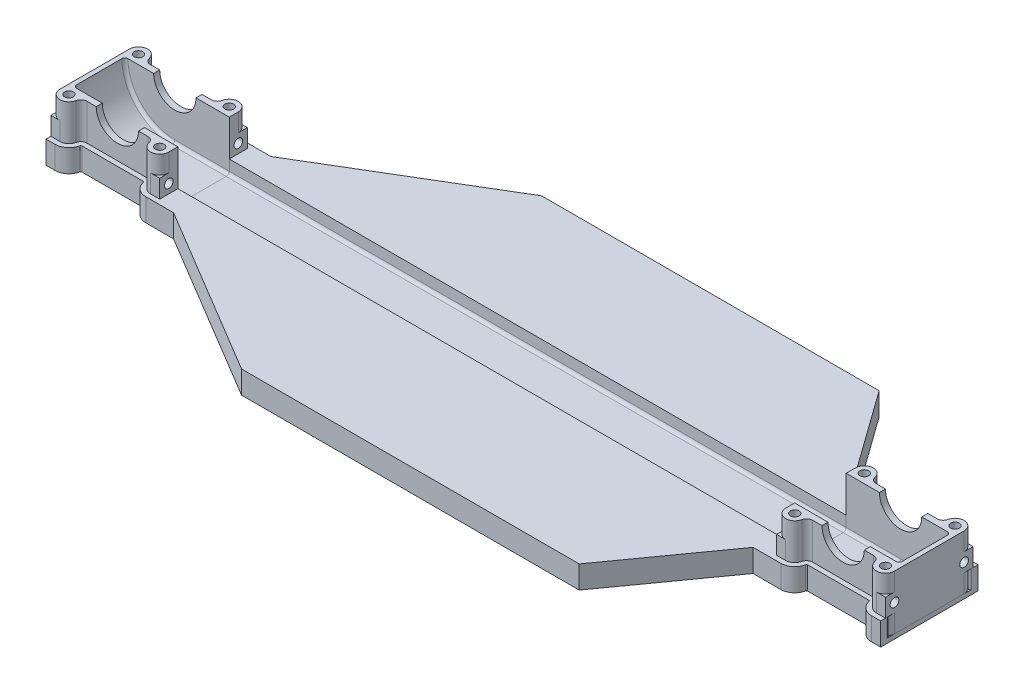
from build123d import *

# Parameters (mm, degrees)
BOSS_EXTRUDE1_DEPTH      = 13.493749999999999
BOSS_EXTRUDE2_START      = -16.66875
BOSS_EXTRUDE2_DEPTH      = 3.174999999999999
BOSS_EXTRUDE3_START      = 16.66875
BOSS_EXTRUDE3_DEPTH      = 3.175
BOSS_EXTRUDE4_DEPTH      = 28.575
FILLET3_R                = 1.5875
CUT_EXTRUDE1_DEPTH       = 47.507247839046556
CUT_EXTRUDE1_DEPTH_BACK  = 47.507247839046556
SKETCH2_3_R              = 2.2859999999999983
FILLET7_R                = 3.175
SKETCH3_R                = 2.2859999999999547
SKETCH3_R_2              = 2.286
BOSS_EXTRUDE5_DEPTH      = 2.38125
BOSS_EXTRUDE6_DEPTH      = 2.38125
BOSS_EXTRUDE7_DEPTH      = 9.525
FILLET8_R                = 1.5875
SKETCH4_R                = 2.2859999999999774
SKETCH4_R_2              = 2.2859999999999983
BOSS_EXTRUDE8_DEPTH      = 9.525
SKETCH7_R                = 2.286000000000005
SKETCH7_R_2              = 2.286000000000001
CUT_EXTRUDE7_DEPTH       = 7.9375
CUT_EXTRUDE8_START       = -381
SKETCH7_2_R              = 2.286000000000005
SKETCH7_2_R_2            = 2.286000000000001
CUT_EXTRUDE8_DEPTH       = 7.9375
CUT_EXTRUDE9_START       = -49.2125
SKETCH7_3_R              = 2.286000000000005
SKETCH7_3_R_2            = 2.286000000000001
CUT_EXTRUDE9_DEPTH       = 7.9375
CUT_EXTRUDE10_START      = -430.2125
SKETCH7_4_R              = 2.286000000000005
SKETCH7_4_R_2            = 2.286000000000001
CUT_EXTRUDE10_DEPTH      = 7.9375
CUT_EXTRUDE11_DEPTH      = 421.7101736814342
CUT_EXTRUDE11_DEPTH_BACK = 421.7101736814342
FILLET10_R               = 0.79375


with BuildPart() as part:
    # Sketch1 → Boss-Extrude1 (new, symmetric)
    with BuildSketch(Plane.XY):
        with BuildLine():
            Line((-26.193749999999998, 0), (-28.575, 0))
            ThreePointArc((-28.575, 0), (-20.205576275451392, -20.205576269359803), (-8.61481042e-09, -28.575))
            ThreePointArc((-8.61481042e-09, -28.575), (5.832847445786352, -27.973353672275042), (11.420073814889577, -26.19374999999949))
            Line((11.420073814889678, -26.193749999999998), (0, -26.193749999999998))
            ThreePointArc((1.06e-15, -26.193749999999994), (-18.521778249705125, -18.521778249705125), (-26.193749999999998, 0))
        make_face()
        with BuildLine():
            ThreePointArc((11.420073814889577, -26.19374999999949), (5.832847445786352, -27.973353672275042), (-8.61481042e-09, -28.575))
            Line((-8.61481197e-09, -28.575), (28.574999999999996, -28.575))
            Line((28.574999999999996, -28.575), (28.574999999999996, -26.193749999999998))
            Line((28.574999999999996, -26.193749999999998), (11.420073814889678, -26.193749999999998))
        make_face()
        with BuildLine():
            ThreePointArc((-8.61481042e-09, -28.575), (-20.205576275451392, -20.205576269359803), (-28.575, 0))
            Line((-28.575, 0), (-28.574999999999996, -28.575))
            Line((-28.574999999999996, -28.575), (-8.61481197e-09, -28.575))
        make_face()
    extrude(amount=BOSS_EXTRUDE1_DEPTH, both=True)

    # Sketch1<3> → Boss-Extrude2 (add)
    with BuildSketch(Plane.XY.offset(BOSS_EXTRUDE2_START)):
        with BuildLine():
            ThreePointArc((-8.61481042e-09, -28.575), (-20.205576275451392, -20.205576269359803), (-28.575, 0))
            Line((-28.575, 0), (-28.574999999999996, -28.575))
            Line((-28.574999999999996, -28.575), (-8.61481197e-09, -28.575))
        make_face()
        with BuildLine():
            Line((-26.193749999999998, 0), (-28.575, 0))
            ThreePointArc((-28.575, 0), (-20.205576275451392, -20.205576269359803), (-8.61481042e-09, -28.575))
            ThreePointArc((-8.61481042e-09, -28.575), (5.832847445786352, -27.973353672275042), (11.420073814889577, -26.19374999999949))
            Line((11.420073814889678, -26.193749999999998), (0, -26.193749999999998))
            ThreePointArc((1.06e-15, -26.193749999999994), (-18.521778249705125, -18.521778249705125), (-26.193749999999998, 0))
        make_face()
        with BuildLine():
            ThreePointArc((26.193749999999998, 2.12e-15), (18.52177824970513, -18.52177824970512), (1.06e-15, -26.193749999999994))
            Line((0, -26.193749999999998), (11.420073814889678, -26.193749999999998))
            ThreePointArc((11.420073814889577, -26.19374999999949), (23.904594059097402, -15.655702088049745), (28.575, -3.5e-15))
            Line((28.575, 0), (26.193749999999998, 0))
        make_face()
        with BuildLine():
            ThreePointArc((11.420073814889577, -26.19374999999949), (5.832847445786352, -27.973353672275042), (-8.61481042e-09, -28.575))
            Line((-8.61481197e-09, -28.575), (28.574999999999996, -28.575))
            Line((28.574999999999996, -28.575), (28.574999999999996, -26.193749999999998))
            Line((28.574999999999996, -26.193749999999998), (11.420073814889678, -26.193749999999998))
        make_face()
        with BuildLine():
            ThreePointArc((28.575, -3.5e-15), (23.904594059097402, -15.655702088049745), (11.420073814889577, -26.19374999999949))
            Line((11.420073814889678, -26.193749999999998), (28.574999999999996, -26.193749999999998))
            Line((28.574999999999996, -26.193749999999998), (28.575, 0))
        make_face()
        with BuildLine():
            Line((-11.1125, 0), (-26.193749999999998, 0))
            ThreePointArc((-26.193749999999998, 0), (-18.521778249705125, -18.521778249705125), (1.06e-15, -26.193749999999994))
            ThreePointArc((1.06e-15, -26.193749999999994), (18.52177824970513, -18.52177824970512), (26.193749999999998, 2.12e-15))
            Line((26.193749999999998, 0), (11.1125, 0))
            ThreePointArc((11.112499999999997, 4.2e-16), (-6.8e-16, -11.112499999999997), (-11.1125, 0))
        make_face()
    extrude(amount=BOSS_EXTRUDE2_DEPTH)

    # Sketch1<4> → Boss-Extrude3 (add)
    with BuildSketch(Plane.XY.offset(BOSS_EXTRUDE3_START)):
        with BuildLine():
            ThreePointArc((-8.61481042e-09, -28.575), (-20.205576275451392, -20.205576269359803), (-28.575, 0))
            Line((-28.575, 0), (-28.574999999999996, -28.575))
            Line((-28.574999999999996, -28.575), (-8.61481197e-09, -28.575))
        make_face()
        with BuildLine():
            Line((-26.193749999999998, 0), (-28.575, 0))
            ThreePointArc((-28.575, 0), (-20.205576275451392, -20.205576269359803), (-8.61481042e-09, -28.575))
            ThreePointArc((-8.61481042e-09, -28.575), (5.832847445786352, -27.973353672275042), (11.420073814889577, -26.19374999999949))
            Line((11.420073814889678, -26.193749999999998), (0, -26.193749999999998))
            ThreePointArc((1.06e-15, -26.193749999999994), (-18.521778249705125, -18.521778249705125), (-26.193749999999998, 0))
        make_face()
        with BuildLine():
            ThreePointArc((26.193749999999998, 2.12e-15), (18.52177824970513, -18.52177824970512), (1.06e-15, -26.193749999999994))
            Line((0, -26.193749999999998), (11.420073814889678, -26.193749999999998))
            ThreePointArc((11.420073814889577, -26.19374999999949), (23.904594059097402, -15.655702088049745), (28.575, -3.5e-15))
            Line((28.575, 0), (26.193749999999998, 0))
        make_face()
        with BuildLine():
            ThreePointArc((11.420073814889577, -26.19374999999949), (5.832847445786352, -27.973353672275042), (-8.61481042e-09, -28.575))
            Line((-8.61481197e-09, -28.575), (28.574999999999996, -28.575))
            Line((28.574999999999996, -28.575), (28.574999999999996, -26.193749999999998))
            Line((28.574999999999996, -26.193749999999998), (11.420073814889678, -26.193749999999998))
        make_face()
        with BuildLine():
            ThreePointArc((28.575, -3.5e-15), (23.904594059097402, -15.655702088049745), (11.420073814889577, -26.19374999999949))
            Line((11.420073814889678, -26.193749999999998), (28.574999999999996, -26.193749999999998))
            Line((28.574999999999996, -26.193749999999998), (28.575, 0))
        make_face()
        with BuildLine():
            Line((-11.1125, 0), (-26.193749999999998, 0))
            ThreePointArc((-26.193749999999998, 0), (-18.521778249705125, -18.521778249705125), (1.06e-15, -26.193749999999994))
            ThreePointArc((1.06e-15, -26.193749999999994), (18.52177824970513, -18.52177824970512), (26.193749999999998, 2.12e-15))
            Line((26.193749999999998, 0), (11.1125, 0))
            ThreePointArc((11.112499999999997, 4.2e-16), (-6.8e-16, -11.112499999999997), (-11.1125, 0))
        make_face()
    extrude(amount=-BOSS_EXTRUDE3_DEPTH)

    # Sketch2 → Boss-Extrude4 (add)
    with BuildSketch(Plane.XZ.offset(28.575)):
        with BuildLine():
            Line((-28.574999999999992, 18.256249999999998), (-28.574999999999992, 16.66875))
            Line((-28.575, 16.66875), (-19.32237193946547, 16.668749999999925))
            ThreePointArc((-19.322371939465448, 16.668749999999918), (-23.00715182631851, 22.95016314034973), (-28.574999999999996, 18.256249999999998))
        make_face()
        with BuildLine():
            Line((-28.574999999999996, -16.66875), (-28.574999999999996, -18.256250000000005))
            ThreePointArc((-28.574999999999996, -18.256250000000005), (-23.007151826318506, -22.950163140349737), (-19.322371939465448, -16.66874999999992))
            Line((-19.322371939465473, -16.66874999999993), (-28.575, -16.66875))
        make_face()
        with BuildLine():
            ThreePointArc((28.574999999999996, 18.25625), (23.00715182631851, 22.95016314034973), (19.322371939465448, 16.66874999999992))
            Line((19.32237193946547, 16.668749999999925), (28.575, 16.66875))
            Line((28.574999999999996, 16.668749999999996), (28.574999999999996, 18.25625))
        make_face()
        with BuildLine():
            ThreePointArc((19.32237193946545, -16.668749999999914), (23.007151826318506, -22.950163140349737), (28.574999999999996, -18.25625))
            Line((28.574999999999996, -18.25625), (28.574999999999996, -16.66875))
            Line((28.574999999999996, -16.66875), (19.322371939465476, -16.668749999999925))
        make_face()
    extrude(amount=-BOSS_EXTRUDE4_DEPTH)

    # Fillet3
    fillet3_edges = [part.edges().sort_by_distance(p)[0] for p in [
        (14.287499999999998, -26.19375, 13.493749999999999),
        (-18.52177824970513, -18.521778249705132, 13.493749999999999),
        (-18.52177824970513, -18.521778249705132, -13.493749999999999),
        (14.287499999999998, -26.193749999999998, -13.493749999999999),
    ]]
    fillet(fillet3_edges, radius=FILLET3_R)

    # Sketch2<3> → Cut-Extrude1 (cut, two sides: drawn at the far end of the back side and taken through both)
    with BuildSketch(Plane.XZ.offset(28.575).offset(-CUT_EXTRUDE1_DEPTH_BACK)):
        with Locations(Location((-23.812499999999996, 18.256249999999998, 0), (0, 0, 270))):
            Circle(SKETCH2_3_R)
        with Locations(Location((23.812499999999996, 18.256249999999998, 0), (0, 0, 270))):
            Circle(SKETCH2_3_R)
        with Locations(Location((23.812499999999996, -18.256250000000005, 0), (0, 0, 270))):
            Circle(SKETCH2_3_R)
        with Locations(Location((-23.812499999999996, -18.256250000000005, 0), (0, 0, 270))):
            Circle(SKETCH2_3_R)
    extrude(amount=CUT_EXTRUDE1_DEPTH + CUT_EXTRUDE1_DEPTH_BACK, mode=Mode.SUBTRACT)

    # Fillet7
    fillet7_edges = [part.edges().sort_by_distance(p)[0] for p in [
        (19.322371939465462, -14.2875, -16.668749999999918),
        (-19.322371939465462, -14.2875, 16.66874999999992),
        (19.32237193946546, -14.2875, 16.668749999999925),
        (-19.322371939465462, -14.2875, -16.668749999999925),
    ]]
    fillet(fillet7_edges, radius=FILLET7_R)


with BuildPart() as body_2:
    # Mirror5: mirrored copy
    add(part.part.mirror(Plane(origin=(190.5, 0, 0), x_dir=(0, 0, 1), z_dir=(1, 0, 0))))


with BuildPart() as body_3:
    # Sketch3 → Boss-Extrude5 (new body)
    with BuildSketch(Plane.XZ.offset(28.575)):
        with BuildLine():
            ThreePointArc((357.18750000000057, -25.558750000000014), (361.80600652267617, -23.912742177135762), (364.3424595386697, -19.716749999999998))
            ThreePointArc((364.3424595386697, -19.716750000000005), (364.56302067049523, -19.35188111503166), (364.9646299333366, -19.208749999999977))
            Line((364.9646299333366, -19.20874999999999), (397.0353700666634, -19.20875))
            ThreePointArc((397.0353700666634, -19.208749999999995), (397.43697932950477, -19.351881115031684), (397.6575404613303, -19.716749999999998))
            ThreePointArc((397.6575404613303, -19.716749999999998), (400.19399347732406, -23.91274217713595), (404.8125, -25.55875000000003))
            Line((404.8125, -25.558750000000007), (412.115, -25.558750000000003))
            Line((412.115, -25.558750000000003), (412.115, 25.558750000000003))
            Line((412.115, 25.558750000000003), (404.8125, 25.55875))
            ThreePointArc((404.8125, 25.558750000000007), (400.19399347732406, 23.91274217713594), (397.6575404613303, 19.716750000000005))
            ThreePointArc((397.6575404613303, 19.716750000000005), (397.43697932950477, 19.35188111503166), (397.0353700666634, 19.208749999999977))
            Line((397.0353700666634, 19.20874999999999), (364.9646299333366, 19.208749999999995))
            ThreePointArc((364.9646299333366, 19.208749999999995), (364.56302067049523, 19.35188111503167), (364.3424595386697, 19.716749999999998))
            ThreePointArc((364.3424595386697, 19.716749999999998), (361.8060065138446, 23.912742184346733), (357.1874999771975, 25.558750000000025))
            Line((357.1874999771975, 25.558750000000003), (342.6173646408551, 25.558750000000003))
            Line((342.6173646408551, 25.558750000000003), (304.517364640855, 78.74))
            Line((304.517364640855, 78.74), (127.28263535914483, 78.74))
            Line((127.28263535914483, 78.74000000000001), (38.3826353591449, 25.558750000000003))
            Line((38.3826353591449, 25.558750000000003), (23.8125000000006, 25.558750000000003))
            ThreePointArc((23.8125000000006, 25.55875), (19.193993477324312, 23.91274217713612), (16.657540461330335, 19.71675))
            ThreePointArc((16.657540461330335, 19.71675), (16.436979329504776, 19.351881115031677), (16.035370066663408, 19.20875))
            Line((16.035370066663408, 19.20875), (-16.035370066663408, 19.208749999999924))
            ThreePointArc((-16.035370066663408, 19.208749999999924), (-16.43697932950482, 19.351881115031606), (-16.65754046133034, 19.71675))
            ThreePointArc((-16.65754046133034, 19.71675), (-19.193993477324085, 23.912742177135925), (-23.812499999999996, 25.558749999999993))
            Line((-23.812499999999996, 25.55875), (-31.115, 25.558750000000003))
            Line((-31.115, 25.558750000000003), (-31.115, -25.558750000000003))
            Line((-31.115, -25.558750000000003), (-23.812499999999996, -25.558750000000003))
            ThreePointArc((-23.812499999999996, -25.558750000000003), (-19.19399347732408, -23.912742177135936), (-16.657540461330335, -19.716750000000008))
            ThreePointArc((-16.65754046133034, -19.716750000000008), (-16.4369793295048, -19.351881115031652), (-16.035370066663404, -19.20875))
            Line((-16.035370066663404, -19.20875), (16.035370066663404, -19.20875))
            ThreePointArc((16.035370066663404, -19.20875), (16.43697932950478, -19.35188111503167), (16.657540461330335, -19.71675))
            ThreePointArc((16.65754046133033, -19.71675), (19.19399346849272, -23.91274216992516), (23.81249997719753, -25.55875))
            Line((23.81249997719753, -25.558750000000003), (38.382635359144885, -25.558750000000003))
            Line((38.382635359144885, -25.558750000000003), (127.28263535914483, -78.74))
            Line((127.28263535914483, -78.74), (304.5173646408551, -78.74))
            Line((304.5173646408551, -78.74), (342.6173646408551, -25.558750000000003))
            Line((342.6173646408551, -25.558750000000003), (357.18750000000057, -25.558750000000003))
        make_face()
        with Locations(Location((357.1875, -18.256250000000005, 0), (0, 0, 90))):
            Circle(SKETCH3_R, mode=Mode.SUBTRACT)
        with Locations(Location((404.8125, -18.256250000000005, 0), (0, 0, 90))):
            Circle(SKETCH3_R, mode=Mode.SUBTRACT)
        with Locations(Location((357.1875, 18.256249999999998, 0), (0, 0, 90))):
            Circle(SKETCH3_R, mode=Mode.SUBTRACT)
        with Locations(Location((404.8125, 18.256249999999998, 0), (0, 0, 90))):
            Circle(SKETCH3_R, mode=Mode.SUBTRACT)
        with Locations(Location((-23.812499999999996, -18.256250000000005, 0), (0, 0, 90))):
            Circle(SKETCH3_R_2, mode=Mode.SUBTRACT)
        with Locations(Location((23.812499999999996, 18.256249999999998, 0), (0, 0, 90))):
            Circle(SKETCH3_R_2, mode=Mode.SUBTRACT)
        with Locations(Location((-23.812499999999996, 18.256249999999998, 0), (0, 0, 90))):
            Circle(SKETCH3_R_2, mode=Mode.SUBTRACT)
        with Locations(Location((23.812499999999996, -18.256250000000005, 0), (0, 0, 90))):
            Circle(SKETCH3_R_2, mode=Mode.SUBTRACT)
    extrude(amount=BOSS_EXTRUDE5_DEPTH)

    # Sketch3<4> → Boss-Extrude6 (add)
    with BuildSketch(Plane.XZ.offset(28.575)):
        with BuildLine():
            ThreePointArc((357.18750000000057, -25.558750000000014), (361.80600652267617, -23.912742177135762), (364.3424595386697, -19.716749999999998))
            ThreePointArc((364.3424595386697, -19.716750000000005), (364.56302067049523, -19.35188111503166), (364.9646299333366, -19.208749999999977))
            Line((364.9646299333366, -19.20874999999999), (397.0353700666634, -19.20875))
            ThreePointArc((397.0353700666634, -19.208749999999995), (397.43697932950477, -19.351881115031684), (397.6575404613303, -19.716749999999998))
            ThreePointArc((397.6575404613303, -19.716749999999998), (400.19399347732406, -23.91274217713595), (404.8125, -25.55875000000003))
            Line((404.8125, -25.558750000000007), (412.115, -25.558750000000003))
            Line((412.115, -25.558750000000003), (412.115, 25.558750000000003))
            Line((412.115, 25.558750000000003), (404.8125, 25.55875))
            ThreePointArc((404.8125, 25.558750000000007), (400.19399347732406, 23.91274217713594), (397.6575404613303, 19.716750000000005))
            ThreePointArc((397.6575404613303, 19.716750000000005), (397.43697932950477, 19.35188111503166), (397.0353700666634, 19.208749999999977))
            Line((397.0353700666634, 19.20874999999999), (364.9646299333366, 19.208749999999995))
            ThreePointArc((364.9646299333366, 19.208749999999995), (364.56302067049523, 19.35188111503167), (364.3424595386697, 19.716749999999998))
            ThreePointArc((364.3424595386697, 19.716749999999998), (361.8060065138446, 23.912742184346733), (357.1874999771975, 25.558750000000025))
            Line((357.1874999771975, 25.558750000000003), (342.6173646408551, 25.558750000000003))
            Line((342.6173646408551, 25.558750000000003), (304.517364640855, 78.74))
            Line((304.517364640855, 78.74), (127.28263535914483, 78.74))
            Line((127.28263535914483, 78.74000000000001), (38.3826353591449, 25.558750000000003))
            Line((38.3826353591449, 25.558750000000003), (23.8125000000006, 25.558750000000003))
            ThreePointArc((23.8125000000006, 25.55875), (19.193993477324312, 23.91274217713612), (16.657540461330335, 19.71675))
            ThreePointArc((16.657540461330335, 19.71675), (16.436979329504776, 19.351881115031677), (16.035370066663408, 19.20875))
            Line((16.035370066663408, 19.20875), (-16.035370066663408, 19.208749999999924))
            ThreePointArc((-16.035370066663408, 19.208749999999924), (-16.43697932950482, 19.351881115031606), (-16.65754046133034, 19.71675))
            ThreePointArc((-16.65754046133034, 19.71675), (-19.193993477324085, 23.912742177135925), (-23.812499999999996, 25.558749999999993))
            Line((-23.812499999999996, 25.55875), (-31.115, 25.558750000000003))
            Line((-31.115, 25.558750000000003), (-31.115, -25.558750000000003))
            Line((-31.115, -25.558750000000003), (-23.812499999999996, -25.558750000000003))
            ThreePointArc((-23.812499999999996, -25.558750000000003), (-19.19399347732408, -23.912742177135936), (-16.657540461330335, -19.716750000000008))
            ThreePointArc((-16.65754046133034, -19.716750000000008), (-16.4369793295048, -19.351881115031652), (-16.035370066663404, -19.20875))
            Line((-16.035370066663404, -19.20875), (16.035370066663404, -19.20875))
            ThreePointArc((16.035370066663404, -19.20875), (16.43697932950478, -19.35188111503167), (16.657540461330335, -19.71675))
            ThreePointArc((16.65754046133033, -19.71675), (19.19399346849272, -23.91274216992516), (23.81249997719753, -25.55875))
            Line((23.81249997719753, -25.558750000000003), (38.382635359144885, -25.558750000000003))
            Line((38.382635359144885, -25.558750000000003), (127.28263535914483, -78.74))
            Line((127.28263535914483, -78.74), (304.5173646408551, -78.74))
            Line((304.5173646408551, -78.74), (342.6173646408551, -25.558750000000003))
            Line((342.6173646408551, -25.558750000000003), (357.18750000000057, -25.558750000000003))
        make_face()
        with BuildLine():
            ThreePointArc((352.425, 18.25625), (356.7088260684502, 22.994633428686868), (361.85377796000193, 19.20875))
            ThreePointArc((361.85377796000193, 19.208750000000002), (362.9565836191297, 17.384405575158283), (364.9646299333366, 16.66874999999999))
            Line((364.9646299333366, 16.66875), (397.0353700666634, 16.66875))
            ThreePointArc((397.0353700666634, 16.66875000000001), (399.0434163808703, 17.384405575158294), (400.14622203999807, 19.208749999999995))
            ThreePointArc((400.14622203999807, 19.208749999999995), (405.29117393154985, 22.994633428686942), (409.57500000000005, 18.256249999999998))
            Line((409.57500000000005, 18.256249999999998), (409.57500000000005, -18.256250000000005))
            ThreePointArc((409.57500000000005, -18.256250000000005), (405.29117393154985, -22.994633428686882), (400.14622203999807, -19.208749999999995))
            ThreePointArc((400.14622203999807, -19.208750000000002), (399.0434163808703, -17.384405575158283), (397.0353700666634, -16.66874999999999))
            Line((397.0353700666634, -16.66875), (364.9646299333366, -16.66875))
            ThreePointArc((364.9646299333366, -16.66875000000001), (362.9565836191297, -17.384405575158297), (361.85377796000193, -19.20875))
            ThreePointArc((361.85377796000193, -19.208750000000006), (356.7088260684502, -22.994633428686882), (352.425, -18.25625))
            Line((352.425, -18.25625), (352.425, 18.25625))
        make_face(mode=Mode.SUBTRACT)
        with BuildLine():
            ThreePointArc((28.575, -18.25625), (24.291173931549803, -22.994633428686903), (19.146222039998047, -19.208750000000002))
            ThreePointArc((19.146222039998044, -19.208750000000002), (18.043416380870326, -17.38440557515829), (16.035370066663404, -16.66875))
            Line((16.035370066663404, -16.66875), (-16.035370066663404, -16.66875))
            ThreePointArc((-16.035370066663404, -16.66875), (-18.043416380870326, -17.38440557515829), (-19.146222039998044, -19.208750000000002))
            ThreePointArc((-19.146222039998044, -19.208750000000002), (-24.2911739315498, -22.994633428686907), (-28.574999999999996, -18.256250000000005))
            Line((-28.574999999999996, -18.256250000000005), (-28.574999999999992, 18.256249999999998))
            ThreePointArc((-28.574999999999996, 18.256249999999998), (-24.2911739315498, 22.9946334286869), (-19.146222039998044, 19.20875))
            ThreePointArc((-19.146222039998044, 19.20875), (-18.04341638087033, 17.38440557515829), (-16.035370066663408, 16.66875))
            Line((-16.035370066663408, 16.66875), (16.035370066663408, 16.66875))
            ThreePointArc((16.035370066663408, 16.66875), (18.04341638087033, 17.38440557515829), (19.146222039998044, 19.20875))
            ThreePointArc((19.146222039998044, 19.20875), (24.2911739315498, 22.9946334286869), (28.574999999999996, 18.25625))
            Line((28.574999999999996, 18.25625), (28.574999999999996, -18.25625))
        make_face(mode=Mode.SUBTRACT)
    extrude(amount=-BOSS_EXTRUDE6_DEPTH)

    # Sketch3<5> → Boss-Extrude7 (add)
    with BuildSketch(Plane.XZ.offset(28.575)):
        with BuildLine():
            Line((23.81249997719753, -25.558750000000003), (38.382635359144885, -25.558750000000003))
            Line((38.382635359144885, -25.558750000000003), (127.28263535914483, -78.74))
            Line((127.28263535914483, -78.74), (304.5173646408551, -78.74))
            Line((304.5173646408551, -78.74), (342.6173646408551, -25.558750000000003))
            Line((342.6173646408551, -25.558750000000003), (357.18750000000057, -25.558750000000003))
            ThreePointArc((357.18750000000057, -25.558750000000014), (361.80600652267617, -23.912742177135762), (364.3424595386697, -19.716749999999998))
            ThreePointArc((364.3424595386697, -19.716750000000005), (364.56302067049523, -19.35188111503166), (364.9646299333366, -19.208749999999977))
            Line((364.9646299333366, -19.20874999999999), (397.0353700666634, -19.20875))
            ThreePointArc((397.0353700666634, -19.208749999999995), (397.43697932950477, -19.351881115031684), (397.6575404613303, -19.716749999999998))
            ThreePointArc((397.6575404613303, -19.716749999999998), (400.19399347732406, -23.91274217713595), (404.8125, -25.55875000000003))
            Line((404.8125, -25.558750000000007), (412.115, -25.558750000000003))
            Line((412.115, -25.558750000000003), (412.115, 25.558750000000003))
            Line((412.115, 25.558750000000003), (404.8125, 25.55875))
            ThreePointArc((404.8125, 25.558750000000007), (400.19399347732406, 23.91274217713594), (397.6575404613303, 19.716750000000005))
            ThreePointArc((397.6575404613303, 19.716750000000005), (397.43697932950477, 19.35188111503166), (397.0353700666634, 19.208749999999977))
            Line((397.0353700666634, 19.20874999999999), (364.9646299333366, 19.208749999999995))
            ThreePointArc((364.9646299333366, 19.208749999999995), (364.56302067049523, 19.35188111503167), (364.3424595386697, 19.716749999999998))
            ThreePointArc((364.3424595386697, 19.716749999999998), (361.8060065138446, 23.912742184346733), (357.1874999771975, 25.558750000000025))
            Line((357.1874999771975, 25.558750000000003), (342.6173646408551, 25.558750000000003))
            Line((342.6173646408551, 25.558750000000003), (304.517364640855, 78.74))
            Line((304.517364640855, 78.74), (127.28263535914483, 78.74))
            Line((127.28263535914483, 78.74000000000001), (38.3826353591449, 25.558750000000003))
            Line((38.3826353591449, 25.558750000000003), (23.8125000000006, 25.558750000000003))
            ThreePointArc((23.8125000000006, 25.55875), (19.193993477324312, 23.91274217713612), (16.657540461330335, 19.71675))
            ThreePointArc((16.657540461330335, 19.71675), (16.436979329504776, 19.351881115031677), (16.035370066663408, 19.20875))
            Line((16.035370066663408, 19.20875), (-16.035370066663408, 19.208749999999924))
            ThreePointArc((-16.035370066663408, 19.208749999999924), (-16.43697932950482, 19.351881115031606), (-16.65754046133034, 19.71675))
            ThreePointArc((-16.65754046133034, 19.71675), (-19.193993477324085, 23.912742177135925), (-23.812499999999996, 25.558749999999993))
            Line((-23.812499999999996, 25.55875), (-31.115, 25.558750000000003))
            Line((-31.115, 25.558750000000003), (-31.115, -25.558750000000003))
            Line((-31.115, -25.558750000000003), (-23.812499999999996, -25.558750000000003))
            ThreePointArc((-23.812499999999996, -25.558750000000003), (-19.19399347732408, -23.912742177135936), (-16.657540461330335, -19.716750000000008))
            ThreePointArc((-16.65754046133034, -19.716750000000008), (-16.4369793295048, -19.351881115031652), (-16.035370066663404, -19.20875))
            Line((-16.035370066663404, -19.20875), (16.035370066663404, -19.20875))
            ThreePointArc((16.035370066663404, -19.20875), (16.43697932950478, -19.35188111503167), (16.657540461330335, -19.71675))
            ThreePointArc((16.65754046133033, -19.71675), (19.19399346849272, -23.91274216992516), (23.81249997719753, -25.55875))
        make_face()
        with BuildLine():
            Line((352.425, 13.493749999999999), (352.425, 18.25625))
            ThreePointArc((352.425, 18.25625), (356.7088260684502, 22.994633428686868), (361.85377796000193, 19.20875))
            ThreePointArc((361.85377796000193, 19.208750000000002), (362.9565836191297, 17.384405575158283), (364.9646299333366, 16.66874999999999))
            Line((364.9646299333366, 16.66875), (397.0353700666634, 16.66875))
            ThreePointArc((397.0353700666634, 16.66875000000001), (399.0434163808703, 17.384405575158294), (400.14622203999807, 19.208749999999995))
            ThreePointArc((400.14622203999807, 19.208749999999995), (405.29117393154985, 22.994633428686942), (409.57500000000005, 18.256249999999998))
            Line((409.57500000000005, 18.256249999999998), (409.57500000000005, -18.256250000000005))
            ThreePointArc((409.57500000000005, -18.256250000000005), (405.29117393154985, -22.994633428686882), (400.14622203999807, -19.208749999999995))
            ThreePointArc((400.14622203999807, -19.208750000000002), (399.0434163808703, -17.384405575158283), (397.0353700666634, -16.66874999999999))
            Line((397.0353700666634, -16.66875), (364.9646299333366, -16.66875))
            ThreePointArc((364.9646299333366, -16.66875000000001), (362.9565836191297, -17.384405575158297), (361.85377796000193, -19.20875))
            ThreePointArc((361.85377796000193, -19.208750000000006), (356.7088260684502, -22.994633428686882), (352.425, -18.25625))
            Line((352.425, -18.25625), (352.425, -13.493749999999999))
            Line((352.425, -13.493749999999999), (28.57499999999999, -13.493749999999999))
            Line((28.574999999999996, -13.493749999999999), (28.574999999999996, -18.25625))
            ThreePointArc((28.575, -18.25625), (24.291173931549803, -22.994633428686903), (19.146222039998047, -19.208750000000002))
            ThreePointArc((19.146222039998044, -19.208750000000002), (18.043416380870326, -17.38440557515829), (16.035370066663404, -16.66875))
            Line((16.035370066663404, -16.66875), (-16.035370066663404, -16.66875))
            ThreePointArc((-16.035370066663404, -16.66875), (-18.043416380870326, -17.38440557515829), (-19.146222039998044, -19.208750000000002))
            ThreePointArc((-19.146222039998044, -19.208750000000002), (-24.2911739315498, -22.994633428686907), (-28.574999999999996, -18.256250000000005))
            Line((-28.574999999999996, -18.256250000000005), (-28.574999999999992, 18.256249999999998))
            ThreePointArc((-28.574999999999996, 18.256249999999998), (-24.2911739315498, 22.9946334286869), (-19.146222039998044, 19.20875))
            ThreePointArc((-19.146222039998044, 19.20875), (-18.04341638087033, 17.38440557515829), (-16.035370066663408, 16.66875))
            Line((-16.035370066663408, 16.66875), (16.035370066663408, 16.66875))
            ThreePointArc((16.035370066663408, 16.66875), (18.04341638087033, 17.38440557515829), (19.146222039998044, 19.20875))
            ThreePointArc((19.146222039998044, 19.20875), (24.2911739315498, 22.9946334286869), (28.574999999999996, 18.25625))
            Line((28.574999999999996, 18.25625), (28.574999999999996, 13.493749999999999))
            Line((28.575, 13.493749999999999), (352.425, 13.493749999999999))
        make_face(mode=Mode.SUBTRACT)
    extrude(amount=-BOSS_EXTRUDE7_DEPTH)

    # Fillet8
    fillet8_edges = [body_3.edges().sort_by_distance(p)[0] for p in [
        (190.5, -26.193749999999998, 13.493749999999999),
        (190.5, -26.193749999999998, -13.493749999999999),
    ]]
    fillet(fillet8_edges, radius=FILLET8_R)

    # Sketch8 → Cut-Extrude11 (cut, two sides: drawn at the far end of the back side and taken through both)
    with BuildSketch(Plane.XZ.offset(30.95625).offset(-CUT_EXTRUDE11_DEPTH_BACK)):
        Polygon((-28.574999999999992, 18.256249999999998), (-28.574999999999992, 25.558750000000003), (-31.115, 25.558750000000003), (-31.115, -25.558750000000003), (-28.57499999999999, -25.558750000000003), (-28.57499999999999, -18.25625000000001), align=None)
        Polygon((412.115, 25.558750000000003), (409.57500000000005, 25.558750000000003), (409.57500000000005, 18.256249999999994), (409.57500000000005, -18.25625), (409.57500000000005, -25.558750000000003), (412.115, -25.558750000000003), align=None)
    extrude(amount=CUT_EXTRUDE11_DEPTH + CUT_EXTRUDE11_DEPTH_BACK, mode=Mode.SUBTRACT)

    # Fillet10
    fillet10_edges = [body_3.edges().sort_by_distance(p)[0] for p in [
        (409.57500000000005, -23.8125, -18.256250000000005),
        (-28.574999999999996, -23.8125, -18.256250000000005),
    ]]
    fillet(fillet10_edges, radius=FILLET10_R)
    fillet10_2_edges = [body_3.edges().sort_by_distance(p)[0] for p in [
        (409.57500000000005, -23.8125, 18.256249999999998),
        (-28.574999999999996, -23.8125, 18.256249999999998),
    ]]
    fillet(fillet10_2_edges, radius=FILLET10_R)


with BuildPart() as part_1:
    add(part.part)

    add(body_2.part)  # Boss-Extrude8 merges body 2
    # Sketch4 → Boss-Extrude8 (add)
    with BuildSketch(Plane(origin=(0, -19.049999999999997, 0), x_dir=(1, 0, 0), z_dir=(0, 1, 0))):
        with BuildLine():
            Line((-28.574999999999992, 23.01875000000001), (-28.574999999999992, 18.256250000000005))
            ThreePointArc((-28.574999999999996, 18.256250000000005), (-27.18009604540094, 21.623846045400924), (-23.812500000000032, 23.018750000000004))
            Line((-23.812500000000032, 23.01875000000001), (-28.574999999999992, 23.01875000000001))
        make_face()
        with BuildLine():
            ThreePointArc((-23.812500000000036, -23.018749999999994), (-27.18009604540094, -21.623846045400914), (-28.574999999999996, -18.256249999999998))
            Line((-28.575000000000006, -18.256249999999998), (-28.575000000000006, -23.01875))
            Line((-28.575000000000006, -23.01875), (-23.812500000000036, -23.01875))
        make_face()
        with BuildLine():
            ThreePointArc((23.812500000000057, 23.018750000000004), (27.18009604540095, 21.623846045400914), (28.574999999999996, 18.25625))
            Line((28.575, 18.25625), (28.575, 23.01875000000001))
            Line((28.575, 23.01875000000001), (23.812500000000057, 23.01875000000001))
        make_face()
        with BuildLine():
            Line((28.575, -23.018749999999994), (28.575, -18.25625))
            ThreePointArc((28.574999999999996, -18.25625), (27.180096045400933, -21.623846045400924), (23.812500000000014, -23.018749999999997))
            Line((23.812500000000014, -23.018749999999994), (28.575, -23.018749999999994))
        make_face()
        with BuildLine():
            Line((409.57500000000005, 23.018750000000015), (404.812500007034, 23.018750000000015))
            ThreePointArc((404.812500007034, 23.018750000000047), (408.1800960478879, 21.6238460429141), (409.57500000000005, 18.256250000000005))
            Line((409.57500000000005, 18.256250000000005), (409.57500000000005, 23.018750000000015))
        make_face()
        with BuildLine():
            Line((409.57500000000005, -23.018750000000004), (409.57500000000005, -18.256249999999998))
            ThreePointArc((409.57500000000005, -18.256249999999998), (408.180096045401, -21.623846045400896), (404.8125000000001, -23.018749999999972))
            Line((404.8125000000001, -23.01875), (409.57500000000005, -23.018750000000004))
        make_face()
        with BuildLine():
            ThreePointArc((357.18749999999994, -23.018749999999976), (353.81990395459906, -21.623846045400896), (352.425, -18.25625))
            Line((352.425, -18.25625), (352.425, -23.018749999999994))
            Line((352.425, -23.018749999999994), (357.18749999999994, -23.018749999999994))
        make_face()
        with BuildLine():
            Line((352.425, 23.01875000000001), (352.425, 18.25625))
            ThreePointArc((352.425, 18.25625), (353.81990395459906, 21.623846045400896), (357.18749999999994, 23.018749999999976))
            Line((357.18749999999994, 23.01875000000001), (352.425, 23.01875000000001))
        make_face()
        with Locations((404.8125, 18.256250000000005)):
            Circle(SKETCH4_R)
        with Locations((404.8125, -18.256249999999998)):
            Circle(SKETCH4_R)
        with Locations((357.1875, -18.256249999999998)):
            Circle(SKETCH4_R)
        with Locations((357.1875, 18.256250000000005)):
            Circle(SKETCH4_R)
        with Locations((-23.812499999999996, 18.256250000000005)):
            Circle(SKETCH4_R_2)
        with Locations((23.812499999999996, 18.256250000000005)):
            Circle(SKETCH4_R_2)
        with Locations((23.812499999999996, -18.256249999999998)):
            Circle(SKETCH4_R_2)
        with Locations((-23.812499999999996, -18.256249999999998)):
            Circle(SKETCH4_R_2)
    extrude(amount=BOSS_EXTRUDE8_DEPTH)

    # Sketch7 → Cut-Extrude7 (cut)
    with BuildSketch(Plane.ZY.offset(28.575)):
        with Locations(Location((-18.256250000000012, -14.287499999999994, 0), (0, 0, 270))):
            Circle(SKETCH7_R)
        with Locations(Location((18.25625, -14.287499999999994, 0), (0, 0, 270))):
            Circle(SKETCH7_R_2)
    extrude(amount=-CUT_EXTRUDE7_DEPTH, mode=Mode.SUBTRACT)

    # Sketch7<2> → Cut-Extrude8 (cut)
    with BuildSketch(Plane.ZY.offset(28.575).offset(CUT_EXTRUDE8_START)):
        with Locations(Location((-18.256250000000012, -14.287499999999994, 0), (0, 0, 90))):
            Circle(SKETCH7_2_R)
        with Locations(Location((18.25625, -14.287499999999994, 0), (0, 0, 90))):
            Circle(SKETCH7_2_R_2)
    extrude(amount=-CUT_EXTRUDE8_DEPTH, mode=Mode.SUBTRACT)

    # Sketch7<3> → Cut-Extrude9 (cut)
    with BuildSketch(Plane.ZY.offset(28.575).offset(CUT_EXTRUDE9_START)):
        with Locations(Location((-18.256250000000012, -14.287499999999994, 0), (0, 0, 90))):
            Circle(SKETCH7_3_R)
        with Locations(Location((18.25625, -14.287499999999994, 0), (0, 0, 90))):
            Circle(SKETCH7_3_R_2)
    extrude(amount=-CUT_EXTRUDE9_DEPTH, mode=Mode.SUBTRACT)

    # Sketch7<4> → Cut-Extrude10 (cut)
    with BuildSketch(Plane.ZY.offset(28.575).offset(CUT_EXTRUDE10_START)):
        with Locations(Location((-18.256250000000012, -14.287499999999994, 0), (0, 0, 90))):
            Circle(SKETCH7_4_R)
        with Locations(Location((18.25625, -14.287499999999994, 0), (0, 0, 90))):
            Circle(SKETCH7_4_R_2)
    extrude(amount=-CUT_EXTRUDE10_DEPTH, mode=Mode.SUBTRACT)


solid = Compound([body_3.part, part_1.part])
